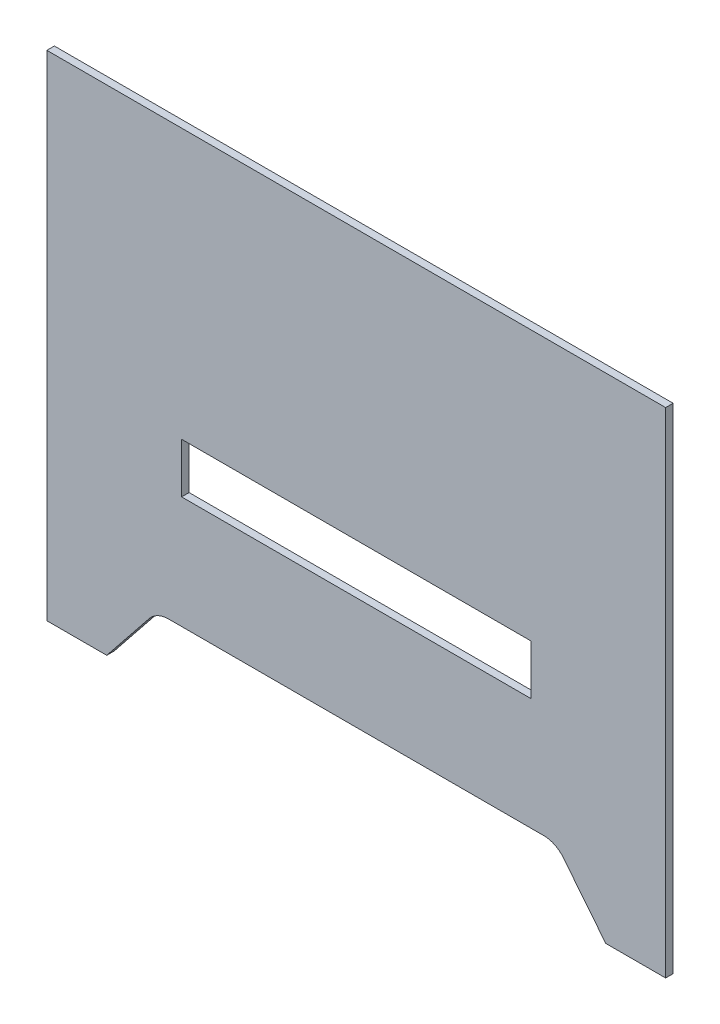
from build123d import *

# Parameters (mm, degrees)
SKETCH1_W           = 140
SKETCH1_H           = 20
BOSS_EXTRUDE1_DEPTH = 3


with BuildPart() as part:
    # Sketch1 → Boss-Extrude1 (new body)
    with BuildSketch(Plane.XY):
        with BuildLine():
            Line((-124, -99), (-124, 99))
            Line((-124, 99), (124, 99))
            Line((124, 99), (124, -99))
            Line((124, -99), (100, -99))
            Line((100, -99), (83.00243962, -77.753049524))
            ThreePointArc((83.00243962, -77.753049524), (79.52563883, -74.986967637), (75.193751525, -74))
            Line((75.193751525, -74), (-75.193751525, -74))
            ThreePointArc((-75.193751525, -74), (-79.52563883, -74.986967637), (-83.00243962, -77.753049524))
            Line((-83.00243962, -77.753049524), (-100, -99))
            Line((-100, -99), (-124, -99))
        make_face()
        with Locations((0, -19)):
            Rectangle(SKETCH1_W, SKETCH1_H, mode=Mode.SUBTRACT)
    extrude(amount=BOSS_EXTRUDE1_DEPTH)


solid = part.part
